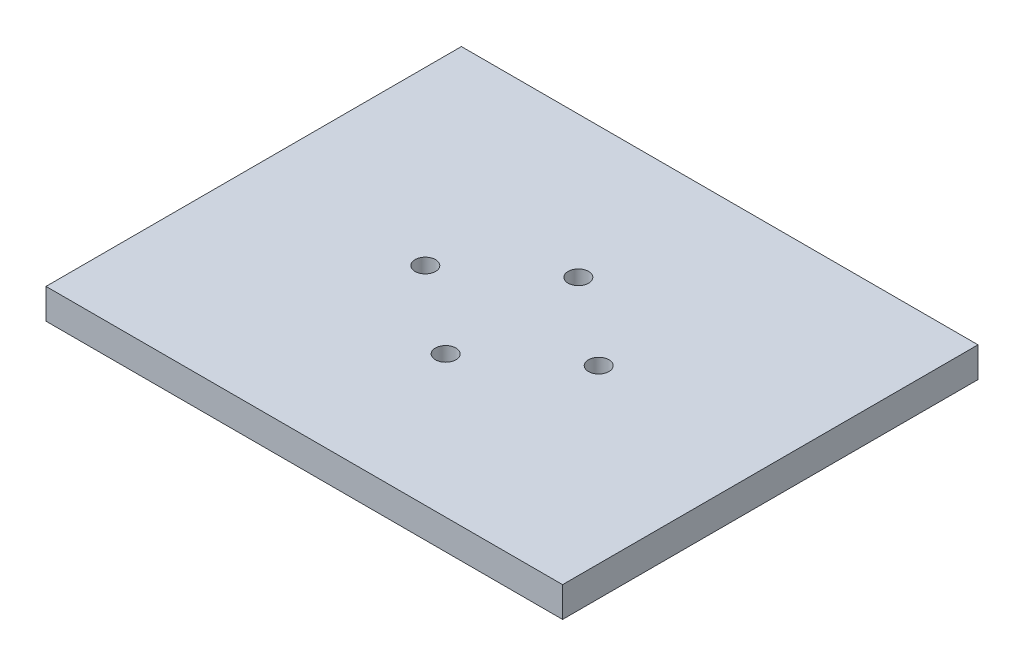
from build123d import *

# Parameters (mm, degrees)
SKETCH1_R           = 1.7
BOSS_EXTRUDE1_DEPTH = 5


with BuildPart() as part:
    # Sketch1 → Boss-Extrude1 (new body)
    with BuildSketch(Plane(origin=(0, 0, 0), x_dir=(1, 0, 0), z_dir=(0, 1, 0))):
        Polygon((42.825, 26.738412941), (42.825, 34.437743191), (33.250510286, 34.437743191), (-33.250510286, 34.437743191), (-42.825, 34.437743191), (-42.825, 26.738412941), (-42.825, -26.738412941), (-42.825, -34.437743191), (-33.250510286, -34.437743191), (33.250510286, -34.437743191), (42.825, -34.437743191), (42.825, -26.738412941), align=None)
        with Locations((0, 11)):
            Circle(SKETCH1_R, mode=Mode.SUBTRACT)
        with Locations((-14.375, 0)):
            Circle(SKETCH1_R, mode=Mode.SUBTRACT)
        with Locations((0, -11)):
            Circle(SKETCH1_R, mode=Mode.SUBTRACT)
        with Locations((14.375, 0)):
            Circle(SKETCH1_R, mode=Mode.SUBTRACT)
    extrude(amount=BOSS_EXTRUDE1_DEPTH)


solid = part.part
